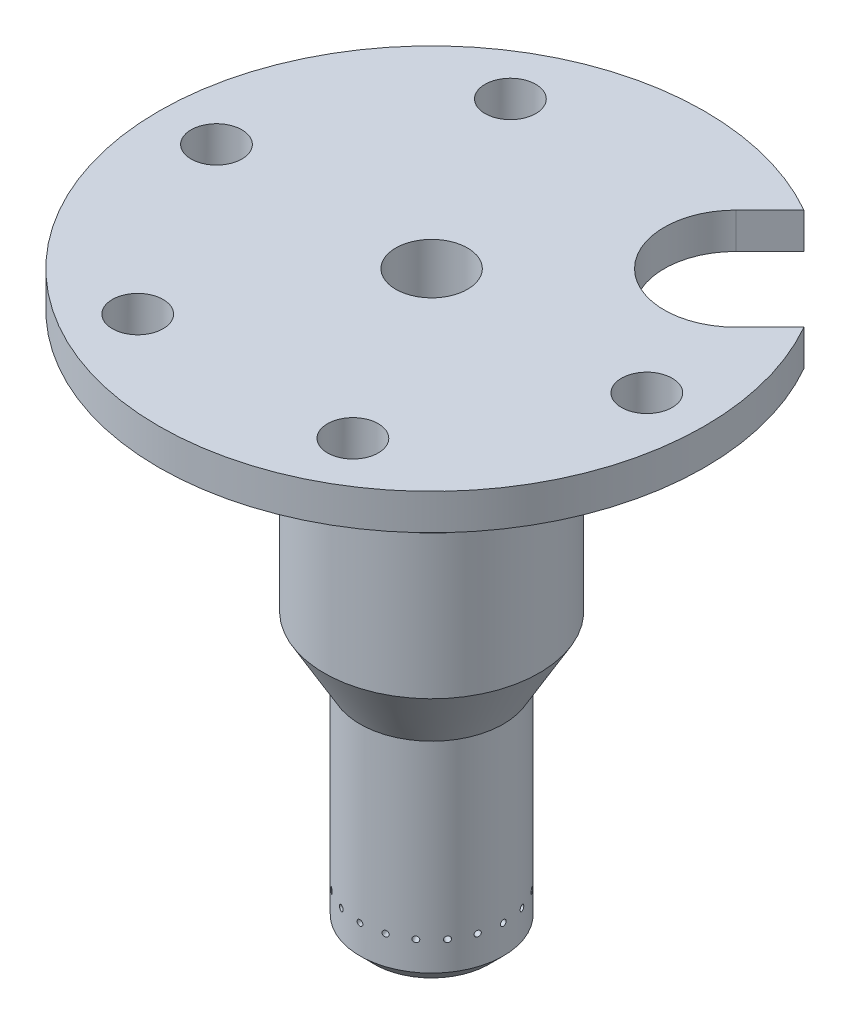
from build123d import *

# Parameters (mm, degrees)
CHAMFER1_SIZE                   = 1.27
CIRPATTERN2_COUNT               = 20
F_1_4_0_25_DIAMETER_HOLE1_D     = 6.35
F_1_4_0_25_DIAMETER_HOLE1_DEPTH = 46.99
F_1_4_0_25_DIAMETER_HOLE1_TIP   = 1.907732465
F_8_CLEARANCE_HOLE1_D           = 4.4958
CIRPATTERN3_COUNT               = 6
CUT_EXTRUDE1_DEPTH              = 62.217699224
CUT_EXTRUDE1_DEPTH_BACK         = 3.175
SKETCH14_R                      = 0.254


with BuildPart() as part:
    # Sketch1 → Revolve1 (revolve)
    with BuildSketch(Plane.XY):
        Polygon((6.35, 0), (6.35, 19.05), (9.525, 24.549261314), (9.525, 37.249261314), (11.8999, 39.624161314), (11.8999, 47.625), (24.1554, 47.625), (24.1554, 50.8), (12.7, 50.8), (0, 50.8), (0, 0), align=None)
    revolve(axis=Axis((0, 0, 0), (0, 1, 0)))

    # Chamfer1
    chamfer1_edges = [part.edges().sort_by_distance(p)[0] for p in [
        (-6.35, 0, 0),
    ]]
    chamfer(chamfer1_edges, length=CHAMFER1_SIZE)

    # Sketch3 → #76 (0.02) Diameter Hole1 (revolve, cut)
    with BuildSketch(Plane(origin=(6.35, 3.81, 0), x_dir=(0, 0, -1), z_dir=(0, 1, 0))):
        Polygon((0, 0), (0, 5.232618597), (0.254, 5.08), (0.254, 0), align=None)
    f_76_0_02_diameter_hole1 = revolve(axis=Axis((12.7, 3.81, 0), (-1, 0, 0)), mode=Mode.SUBTRACT)

    # CirPattern2: #76 (0.02) Diameter Hole1 ×20 about axis
    cirpattern2_axis = Axis((0, 0, 0), (0, -1, 0))
    for i in range(1, CIRPATTERN2_COUNT):
        add(f_76_0_02_diameter_hole1.rotate(cirpattern2_axis, i * 360 / CIRPATTERN2_COUNT), mode=Mode.SUBTRACT)

    # 1/4 (0.25) Diameter Hole1
    with Locations(Plane(origin=(0, 50.8, 0), x_dir=(1, 0, 0), z_dir=(0, 1, 0))):
        with Locations((0, 0)):
            Hole(F_1_4_0_25_DIAMETER_HOLE1_D / 2, depth=F_1_4_0_25_DIAMETER_HOLE1_DEPTH)
            with Locations((0, 0, -(F_1_4_0_25_DIAMETER_HOLE1_DEPTH + F_1_4_0_25_DIAMETER_HOLE1_TIP / 2))):  # 118° drill point
                Cone(0, F_1_4_0_25_DIAMETER_HOLE1_D / 2, F_1_4_0_25_DIAMETER_HOLE1_TIP, mode=Mode.SUBTRACT)

    # #8 Clearance Hole1 (through all)
    with Locations(Plane(origin=(0, 50.8, 0), x_dir=(1, 0, 0), z_dir=(0, 1, 0))):
        with Locations((19.05, 0)):
            f_8_clearance_hole1 = Hole(F_8_CLEARANCE_HOLE1_D / 2)

    # CirPattern3: #8 Clearance Hole1 ×6 about axis, 1 skipped
    cirpattern3_axis = Axis((0, 0, 0), (0, 1, 0))
    add([f_8_clearance_hole1.rotate(cirpattern3_axis, i * 360 / CIRPATTERN3_COUNT) for i in range(1, CIRPATTERN3_COUNT) if i not in (1,)], mode=Mode.SUBTRACT)

    # Sketch12 → Cut-Extrude1 (cut, two sides: drawn at the far end of the back side and taken through both)
    with BuildSketch(Plane(origin=(0, 50.8, 0), x_dir=(1, 0, 0), z_dir=(0, 1, 0)).offset(-CUT_EXTRUDE1_DEPTH_BACK)):
        with BuildLine():
            Line((100.82548006, 109.805736181), (11.989569284, 20.969825405))
            Line((11.989569284, 20.969825405), (8.980256121, 17.960512242))
            ThreePointArc((8.980256121, 17.960512242), (8.980256121, 8.980256121), (17.960512242, 8.980256121))
            Line((17.960512242, 8.980256121), (20.969825405, 11.989569284))
            Line((20.969825405, 11.989569284), (109.805736181, 100.82548006))
            Line((109.805736181, 100.82548006), (287.477557733, 278.497301612))
            Line((287.477557733, 278.497301612), (278.497301612, 287.477557733))
            Line((278.497301612, 287.477557733), (100.82548006, 109.805736181))
        make_face()
    extrude(amount=CUT_EXTRUDE1_DEPTH + CUT_EXTRUDE1_DEPTH_BACK, mode=Mode.SUBTRACT)

    # Sketch14 → relief-cut (revolve, cut)
    with BuildSketch(Plane.XY):
        with Locations((11.8999, 47.625)):
            Circle(SKETCH14_R)
    revolve(axis=Axis((0, 0, 0), (0, 1, 0)), mode=Mode.SUBTRACT)

    # Sketch16 → Groove for AS 568-019, O-Ring1 (revolve, cut)
    with BuildSketch(Plane(origin=(0, 0, 0), x_dir=(0, 0, -1), z_dir=(-1, 0, 0))):
        with BuildLine():
            Line((10.861762441, -42.119923978), (11.9888, -42.021320968))
            Line((11.9888, -42.021320968), (11.9888, -44.580726987))
            Line((11.9888, -44.580726987), (10.861762441, -44.482123978))
            ThreePointArc((10.861762441, -44.482123978), (10.696631556, -44.400690437), (10.6299, -44.229090524))
            Line((10.6299, -44.229090524), (10.6299, -42.372957431))
            ThreePointArc((10.6299, -42.372957431), (10.696631556, -42.201357518), (10.861762441, -42.119923978))
        make_face()
    revolve(axis=Axis((0, -50, 0), (0, 1, 0)), mode=Mode.SUBTRACT)


solid = part.part
